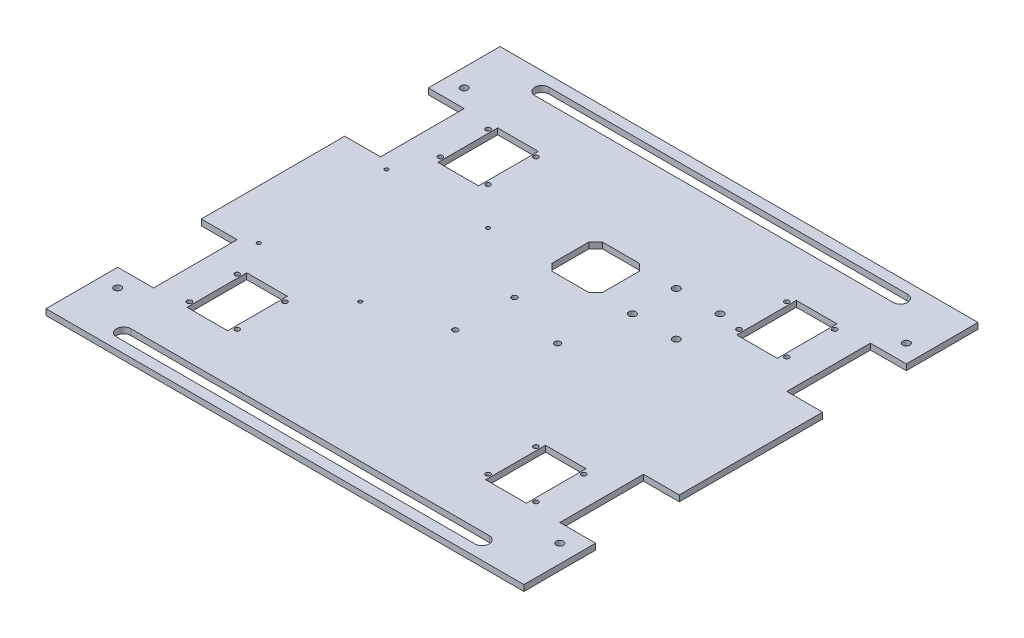
from build123d import *

# Parameters (mm, degrees)
SKETCH_1_W          = 400
SKETCH_1_H          = 380
EXTRUDE_1_DEPTH     = 5
SKETCH_2_R          = 2.25
SKETCH_2_R_2        = 2.5
SKETCH_2_R_3        = 3
SKETCH_2_R_4        = 2
SKETCH_2_R_5        = 1.55
SKETCH_2_W          = 30
SKETCH_2_H          = 70
SKETCH_2_W_2        = 34
SKETCH_2_H_2        = 50
CUT_EXTRUDE_1_DEPTH = 276.907593226


with BuildPart() as part:
    # 草圖1 → 填料-伸長1 (new body)
    with BuildSketch(Plane(origin=(0, 0, 0), x_dir=(1, 0, 0), z_dir=(0, 1, 0))):
        Rectangle(SKETCH_1_W, SKETCH_1_H)
    extrude(amount=EXTRUDE_1_DEPTH)

    # 草圖2 → 除料-伸長1 (cut, through all)
    with BuildSketch(Plane(origin=(0, 5, 0), x_dir=(1, 0, 0), z_dir=(0, 1, 0))):
        with Locations((-13.32, -34.13)):
            Circle(SKETCH_2_R)
        with Locations((-12.05, 14.13)):
            Circle(SKETCH_2_R)
        with Locations((39.25, -1.11)):
            Circle(SKETCH_2_R_2)
        with Locations((-185, 145)):
            Circle(SKETCH_2_R_3)
        with Locations((185, 145)):
            Circle(SKETCH_2_R_3)
        with Locations((-185, -145)):
            Circle(SKETCH_2_R_3)
        with Locations((185, -145)):
            Circle(SKETCH_2_R_3)
        with Locations((49.15, 88.35)):
            Circle(SKETCH_2_R_3)
        with Locations((85.85, 88.35)):
            Circle(SKETCH_2_R_3)
        with Locations((49.15, 51.65)):
            Circle(SKETCH_2_R_3)
        with Locations((85.85, 51.65)):
            Circle(SKETCH_2_R_3)
        with Locations((-145, -85)):
            Circle(SKETCH_2_R_4)
        with Locations((-105, -85)):
            Circle(SKETCH_2_R_4)
        with Locations((-145, -125)):
            Circle(SKETCH_2_R_4)
        with Locations((-105, -125)):
            Circle(SKETCH_2_R_4)
        with Locations((105, -85)):
            Circle(SKETCH_2_R_4)
        with Locations((145, -85)):
            Circle(SKETCH_2_R_4)
        with Locations((105, -125)):
            Circle(SKETCH_2_R_4)
        with Locations((145, -125)):
            Circle(SKETCH_2_R_4)
        with Locations((-145, 125)):
            Circle(SKETCH_2_R_4)
        with Locations((-105, 125)):
            Circle(SKETCH_2_R_4)
        with Locations((-145, 85)):
            Circle(SKETCH_2_R_4)
        with Locations((-105, 85)):
            Circle(SKETCH_2_R_4)
        with Locations((105, 125)):
            Circle(SKETCH_2_R_4)
        with Locations((145, 125)):
            Circle(SKETCH_2_R_4)
        with Locations((105, 85)):
            Circle(SKETCH_2_R_4)
        with Locations((145, 85)):
            Circle(SKETCH_2_R_4)
        with Locations((-158.45, 53.45)):
            Circle(SKETCH_2_R_5)
        with Locations((-73.55, 53.45)):
            Circle(SKETCH_2_R_5)
        with Locations((-158.45, -53.45)):
            Circle(SKETCH_2_R_5)
        with Locations((-73.55, -53.45)):
            Circle(SKETCH_2_R_5)
        with Locations((185, -95)):
            Rectangle(SKETCH_2_W, SKETCH_2_H)
        with Locations((-185, 95)):
            Rectangle(SKETCH_2_W, SKETCH_2_H)
        with Locations((-185, -95)):
            Rectangle(SKETCH_2_W, SKETCH_2_H)
        with Locations((185, 95)):
            Rectangle(SKETCH_2_W, SKETCH_2_H)
        with Locations((-125, -105)):
            Rectangle(SKETCH_2_W_2, SKETCH_2_H_2)
        with Locations((125, -105)):
            Rectangle(SKETCH_2_W_2, SKETCH_2_H_2)
        with Locations((-125, 105)):
            Rectangle(SKETCH_2_W_2, SKETCH_2_H_2)
        with Locations((125, 105)):
            Rectangle(SKETCH_2_W_2, SKETCH_2_H_2)
        Polygon((-21.15, 85.5), (-15.5, 91.15), (15.5, 91.15), (21.15, 85.5), (21.15, 54.5), (15.5, 48.85), (-15.5, 48.85), (-21.15, 54.5), align=None)
        with BuildLine():
            Line((-214.88693476, -145), (-214.88693476, -175))
            ThreePointArc((-214.88693476, -175), (-234.88693476, -195), (-254.88693476, -175))
            Line((-254.88693476, -175), (-254.88693476, -145))
            ThreePointArc((-254.88693476, -145), (-234.88693476, -125), (-214.88693476, -145))
        make_face()
        with BuildLine():
            Line((-214.88693476, 145), (-214.88693476, 175))
            ThreePointArc((-214.88693476, 175), (-234.88693476, 195), (-254.88693476, 175))
            Line((-254.88693476, 175), (-254.88693476, 145))
            ThreePointArc((-254.88693476, 145), (-234.88693476, 125), (-214.88693476, 145))
        make_face()
        with BuildLine():
            Line((214.88693476, -145), (214.88693476, -175))
            ThreePointArc((214.88693476, -175), (234.88693476, -195), (254.88693476, -175))
            Line((254.88693476, -175), (254.88693476, -145))
            ThreePointArc((254.88693476, -145), (234.88693476, -125), (214.88693476, -145))
        make_face()
        with BuildLine():
            Line((214.88693476, 145), (214.88693476, 175))
            ThreePointArc((214.88693476, 175), (234.88693476, 195), (254.88693476, 175))
            Line((254.88693476, 175), (254.88693476, 145))
            ThreePointArc((254.88693476, 145), (234.88693476, 125), (214.88693476, 145))
        make_face()
        with BuildLine():
            Line((-150, 181), (150, 181))
            ThreePointArc((150, 181), (156, 175), (150, 169))
            Line((150, 169), (-150, 169))
            ThreePointArc((-150, 169), (-156, 175), (-150, 181))
        make_face()
        with BuildLine():
            Line((-150, -181), (150, -181))
            ThreePointArc((150, -181), (156, -175), (150, -169))
            Line((150, -169), (-150, -169))
            ThreePointArc((-150, -169), (-156, -175), (-150, -181))
        make_face()
    extrude(amount=-CUT_EXTRUDE_1_DEPTH, mode=Mode.SUBTRACT)


solid = part.part
